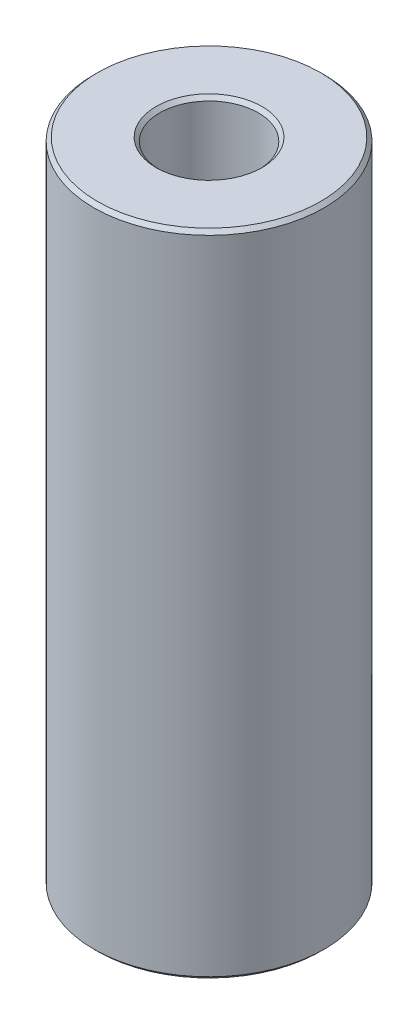
from build123d import *

# Parameters (mm, degrees)
SKETCH1_R           = 40
BOSS_EXTRUDE1_DEPTH = 225.42691237
SKETCH2_R           = 17.130702012
CUT_EXTRUDE1_DEPTH  = 233.41620602
CHAMFER1_SIZE       = 1.267235023


with BuildPart() as part:
    # Sketch1 → Boss-Extrude1 (new body)
    with BuildSketch(Plane(origin=(0, 0, 0), x_dir=(1, 0, 0), z_dir=(0, 1, 0))):
        Circle(SKETCH1_R)
    extrude(amount=BOSS_EXTRUDE1_DEPTH)

    # Sketch2 → Cut-Extrude1 (cut, through all)
    with BuildSketch(Plane(origin=(0, 0, 0), x_dir=(1, 0, 0), z_dir=(0, 1, 0))):
        Circle(SKETCH2_R)
    extrude(amount=CUT_EXTRUDE1_DEPTH, mode=Mode.SUBTRACT)

    # Chamfer1
    chamfer1_edges = [part.edges().sort_by_distance(p)[0] for p in [
        (-17.130702012, 225.42691237, 0),
        (-17.130702012, 0, 0),
        (-40, 0, 0),
        (-40, 225.42691237, 0),
    ]]
    chamfer(chamfer1_edges, length=CHAMFER1_SIZE)


solid = part.part
